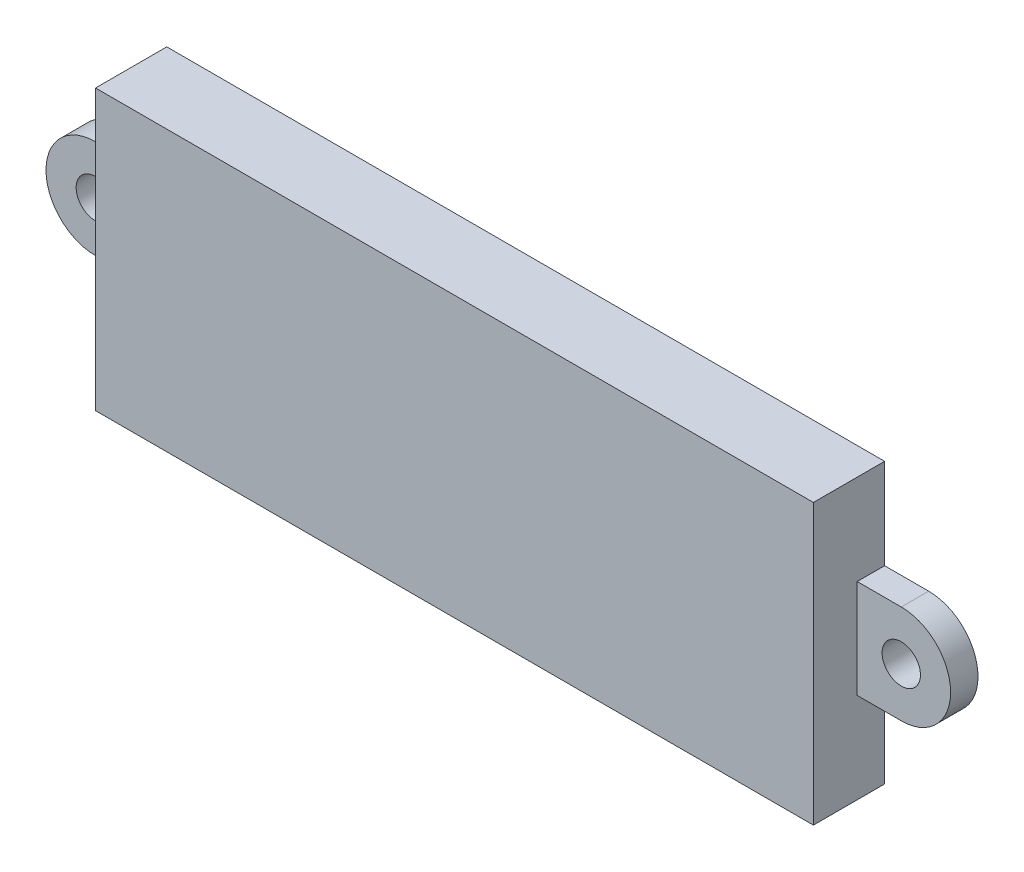
from build123d import *

# Parameters (mm, degrees)
SKETCH_1_W           = 123
SKETCH_1_H           = 43
EXTRUDE_1_DEPTH      = 4
EXTRUDE_2_DEPTH      = 9
EXTRUDE_2_DEPTH_BACK = 4
SKETCH_2_W           = 131
SKETCH_2_H           = 51
SKETCH_2_W_2         = 123
SKETCH_2_H_2         = 43
SKETCH_3_R           = 3.5
EXTRUDE_3_DEPTH      = 5


with BuildPart() as part:
    # Эскиз1 → Бобышка-Вытянуть1 (new body)
    with BuildSketch(Plane.XY):
        with Locations((61.5, 21.5)):
            Rectangle(SKETCH_1_W, SKETCH_1_H)
    extrude(amount=EXTRUDE_1_DEPTH)

    # Эскиз2 → Бобышка-Вытянуть2 (add, two sides: drawn at the far end of the back side and taken through both)
    with BuildSketch(Plane(origin=(0, 0, 0), x_dir=(-1, 0, 0), z_dir=(0, 0, -1)).offset(-EXTRUDE_2_DEPTH_BACK)):
        with Locations((-61.5, 21.5)):
            Rectangle(SKETCH_2_W, SKETCH_2_H)
        with Locations((-61.5, 21.5)):
            Rectangle(SKETCH_2_W_2, SKETCH_2_H_2, mode=Mode.SUBTRACT)
    extrude(amount=EXTRUDE_2_DEPTH + EXTRUDE_2_DEPTH_BACK)

    # Эскиз3 → Бобышка-Вытянуть3 (add)
    with BuildSketch(Plane(origin=(0, 0, -9), x_dir=(-1, 0, 0), z_dir=(0, 0, -1))):
        with BuildLine():
            Line((-127, 12.5), (-135.04002612, 12.5))
            ThreePointArc((-135.04002612, 12.5), (-144.04002612, 21.5), (-135.04002612, 30.5))
            Line((-135.04002612, 30.5), (-127, 30.5))
            Line((-127, 30.5), (-127, 12.5))
        make_face()
        with Locations((-135.04002612, 21.5)):
            Circle(SKETCH_3_R, mode=Mode.SUBTRACT)
    extrude_3 = extrude(amount=-EXTRUDE_3_DEPTH)

    # Зеркальное отражение1: Бобышка-Вытянуть3 across plane
    add(extrude_3.mirror(Plane(origin=(61.5, 0, 0), x_dir=(0, 0, 1), z_dir=(1, 0, 0))))


solid = part.part
